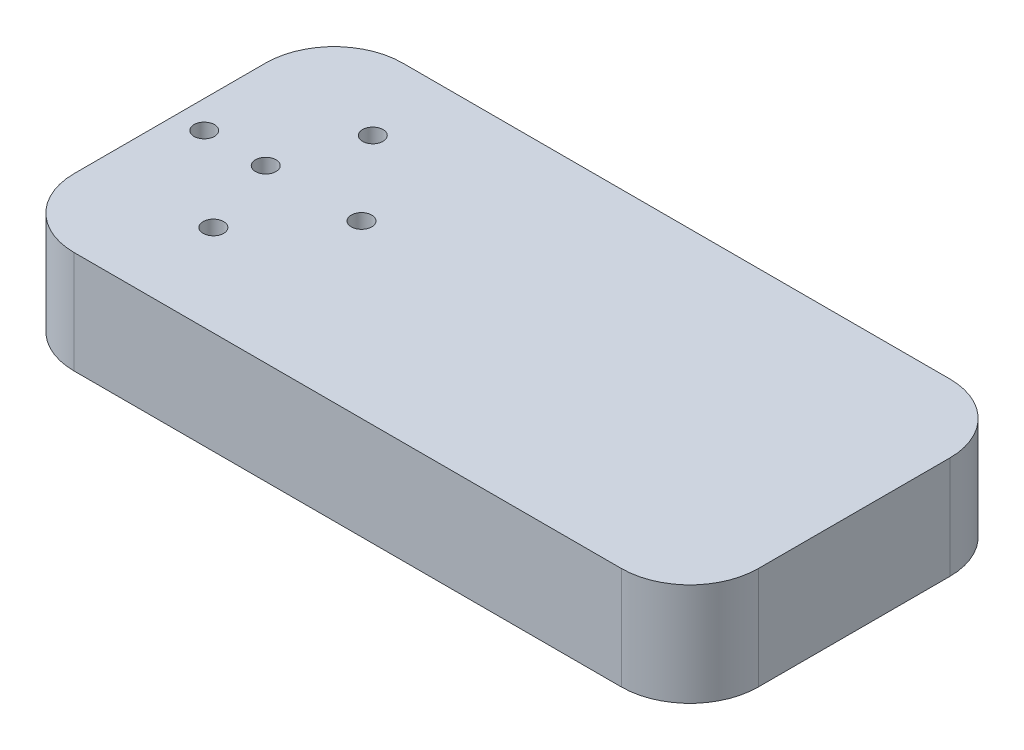
from build123d import *

# Parameters (mm, degrees)
BODY_GLIDER_RIGHT_DEPTH      = 25
BODY_GLIDER_RIGHT_DEPTH_BACK = 23
SKETCH6_W                    = 1.5
SKETCH6_H                    = 10
SKETCH8_W                    = 1.5
SKETCH8_H                    = 10
NUTRIGHTWING_DEPTH           = 34
NUTLEFTWING_DEPTH            = 24
SKETCH19_R                   = 1.5
CUT_EXTRUDE8_DEPTH           = 35
SKETCH20_R                   = 3
CUT_EXTRUDE9_DEPTH           = 5
FILLET4_R                    = 10
SKETCH21_R                   = 1.5
CUT_EXTRUDE10_DEPTH          = 10


with BuildPart() as part:
    # Sketch9 → Body_Glider_Right (new, two sides: drawn at the far end of the back side and taken through both)
    with BuildSketch(Plane.XY.offset(-BODY_GLIDER_RIGHT_DEPTH_BACK)):
        Polygon((100, 0), (0, 0), (0, 15), (9.991154054, 15), (100, 15), align=None)
    extrude(amount=BODY_GLIDER_RIGHT_DEPTH + BODY_GLIDER_RIGHT_DEPTH_BACK)

    # Sketch6 → BallBearingHoleRW (revolve, cut)
    with BuildSketch(Plane(origin=(0, 0, 0), x_dir=(0.8249224516758263, 0, -0.5652459188009622), z_dir=(0.5652459188009622, 0, 0.8249224516758263))):
        with Locations((21.357997716, 17)):
            Rectangle(SKETCH6_W, SKETCH6_H)
    revolve(axis=Axis((17, 15, -11.648586604), (0, 1, 0)), mode=Mode.SUBTRACT)

    # Sketch8 → BallBearingHoleLW (revolve, cut)
    with BuildSketch(Plane(origin=(0, 0, 0), x_dir=(0.8249224516758263, 0, 0.5652459188009623), z_dir=(-0.5652459188009623, 0, 0.8249224516758263))):
        with Locations((19.857997716, 17)):
            Rectangle(SKETCH8_W, SKETCH8_H)
    revolve(axis=Axis((17, 15, 11.648586604), (0, 1, 0)), mode=Mode.SUBTRACT)

    # Sketch14 → NutRightWing (cut)
    with BuildSketch(Plane(origin=(0, 12, 0), x_dir=(0.9996495647624771, -5.6725457664441584e-15, -0.026471638978162328), z_dir=(0, 1, 0))):
        Polygon((19.690646789, -13.572203179), (19.467875207, -10.230989904), (16.462913839, -8.753309115), (13.680724054, -10.616841603), (13.903495637, -13.958054879), (16.908457004, -15.435735667), align=None)
    extrude(amount=-NUTRIGHTWING_DEPTH, mode=Mode.SUBTRACT)

    # Sketch15 → NutLeftWing (cut)
    with BuildSketch(Plane(origin=(0, 12, 0), x_dir=(0.999649564762477, 0, 0.026471638978163528), z_dir=(0, 1, 0))):
        Polygon((13.678575523, 10.621218829), (16.458048785, 8.753637045), (19.465158684, 10.226940608), (19.692795321, 13.567825953), (16.913322059, 15.435407737), (13.90621216, 13.962104175), align=None)
    extrude(amount=-NUTLEFTWING_DEPTH, mode=Mode.SUBTRACT)

    # Sketch19 → Cut-Extrude8 (cut)
    with BuildSketch(Plane(origin=(0, 0, 0), x_dir=(1, 0, 0), z_dir=(0, 1, 0))):
        with Locations((13.001901128, 0)):
            Circle(SKETCH19_R)
        with Locations((27.001901128, 0)):
            Circle(SKETCH19_R)
    extrude(amount=CUT_EXTRUDE8_DEPTH, mode=Mode.SUBTRACT)

    # Sketch20 → Cut-Extrude9 (cut)
    with BuildSketch(Plane.XZ):
        with Locations((13.001901128, 0)):
            Circle(SKETCH20_R)
        with Locations((27.001901128, 0)):
            Circle(SKETCH20_R)
    extrude(amount=-CUT_EXTRUDE9_DEPTH, mode=Mode.SUBTRACT)

    # Fillet4
    fillet4_edges = [part.edges().sort_by_distance(p)[0] for p in [
        (100, 7.5, -23),
        (100, 7.5, 25),
        (0, 7.5, -23),
        (0, 7.5, 25),
    ]]
    fillet(fillet4_edges, radius=FILLET4_R)

    # Sketch21 → Cut-Extrude10 (cut)
    with BuildSketch(Plane(origin=(0, 15, 0), x_dir=(1, 0, 0), z_dir=(0, 1, 0))):
        with Locations((4.055111534, -0.040551115)):
            Circle(SKETCH21_R)
    extrude(amount=-CUT_EXTRUDE10_DEPTH, mode=Mode.SUBTRACT)


solid = part.part
